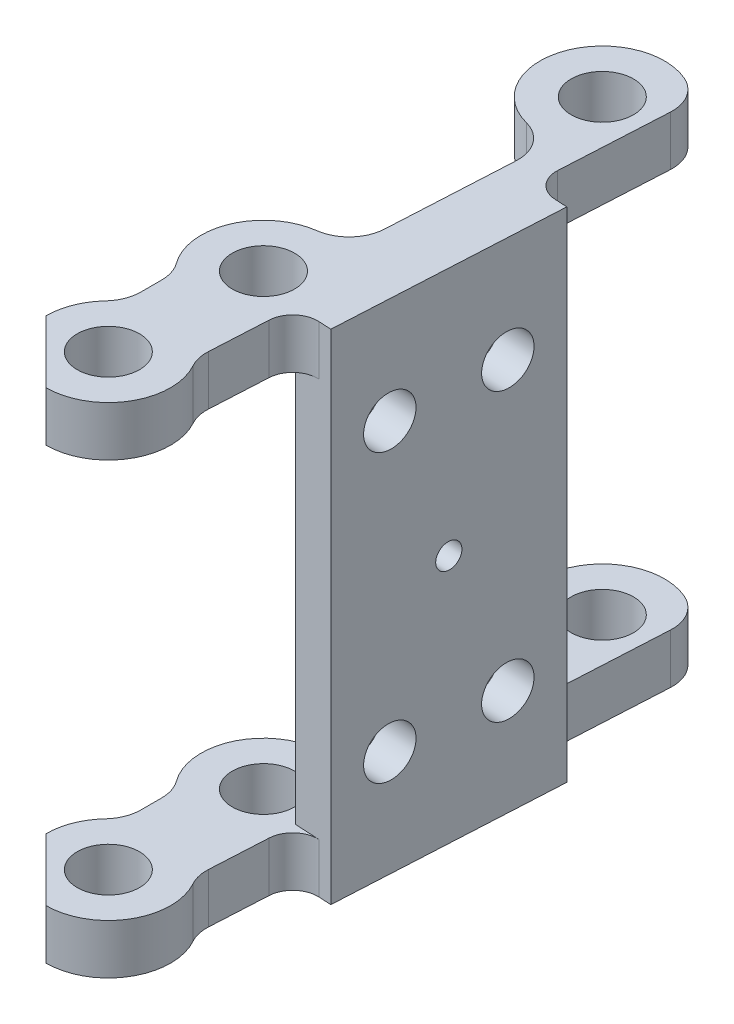
from build123d import *

# Parameters (mm, degrees)
SKETCH2_R           = 2.5
BOSS_EXTRUDE3_DEPTH = 4
BOSS_EXTRUDE4_DEPTH = 40
FILLET1_R           = 2
SKETCH4_R           = 2
SKETCH4_R_2         = 1
CUT_EXTRUDE1_DEPTH  = 10
FILLET3_R           = 3
FILLET4_R           = 3


with BuildPart() as part:
    # Sketch2 → Boss-Extrude3 (new body)
    with BuildSketch(Plane(origin=(0, 0, 0), x_dir=(1, 0, 0), z_dir=(0, 1, 0))):
        with BuildLine():
            ThreePointArc((83.62627208, 73.409646321), (82.043328915, 71.619198109), (81.472187529, 69.298592288))
            Line((81.472187529, 69.298592288), (86.472187529, 64.298592288))
            ThreePointArc((86.472187529, 64.298592288), (90.961711336, 67.097643404), (90.424672494, 72.360921892))
            Line((90.424672494, 72.360921892), (90.926689774, 81.686644374))
            Line((90.926689774, 81.686644374), (92.048119667, 102.518883374))
            Line((92.048119667, 102.518883374), (92.450855554, 110.000305351))
            ThreePointArc((92.450855554, 110.000305351), (83.843337657, 108.444197301), (89.726552777, 101.971283238))
            Line((89.726552777, 101.971283238), (88.863578179, 85.80252536))
            ThreePointArc((88.863578179, 85.80252536), (82.866493913, 83.799788509), (83.62627208, 77.522949199))
            Line((83.62627208, 77.522949199), (83.62627208, 73.409646321))
        make_face()
        with Locations((86.472187529, 69.298592288)):
            Circle(SKETCH2_R, mode=Mode.SUBTRACT)
        with Locations((87.092070964, 81.126869023)):
            Circle(SKETCH2_R, mode=Mode.SUBTRACT)
        with Locations((88.578200606, 106.837625529)):
            Circle(SKETCH2_R, mode=Mode.SUBTRACT)
    boss_extrude3 = extrude(amount=BOSS_EXTRUDE3_DEPTH)

    # Sketch3 → Boss-Extrude4 (add)
    with BuildSketch(Plane(origin=(0, 4, 0), x_dir=(1, 0, 0), z_dir=(0, 1, 0))):
        Polygon((91.800965367, 97.92762227), (90.833399946, 79.953646162), (93.833399946, 79.792151774), (94.800965367, 97.766127883), align=None)
    extrude(amount=-BOSS_EXTRUDE4_DEPTH)

    # Mirror1: Boss-Extrude3 across plane
    add(boss_extrude3.mirror(Plane.ZX.offset(-16)))

    # Fillet1
    fillet1_edges = [part.edges().sort_by_distance(p)[0] for p in [
        (90.833399946, -34, -79.953646162),
        (90.833399946, 2, -79.953646162),
        (91.800965367, -34, -97.92762227),
        (91.800965367, 2, -97.92762227),
    ]]
    fillet(fillet1_edges, radius=FILLET1_R)

    # Sketch4 → Cut-Extrude1 (cut)
    with BuildSketch(Plane(origin=(86.279355648, 0, 4.6445439), x_dir=(-0.05375363451621944, 0, 0.9985542282601866), z_dir=(-0.9985542282601865, 0, -0.05375363451621943))):
        with Locations((-89.220676822, -4.5)):
            Circle(SKETCH4_R)
        with Locations((-98.220676822, -4.5)):
            Circle(SKETCH4_R)
        with Locations((-89.220676822, -27.5)):
            Circle(SKETCH4_R)
        with Locations((-98.220676822, -27.5)):
            Circle(SKETCH4_R)
        with Locations((-93.720676822, -16)):
            Circle(SKETCH4_R_2)
    extrude(amount=-CUT_EXTRUDE1_DEPTH, mode=Mode.SUBTRACT)

    # Fillet3
    fillet3_edges = [part.edges().sort_by_distance(p)[0] for p in [
        (92.450855554, -34, -110.000305351),
        (92.450855554, 2, -110.000305351),
        (90.424672494, -34, -72.360921892),
        (90.424672494, 2, -72.360921892),
        (89.726552777, -34, -101.971283238),
        (89.726552777, 2, -101.971283238),
        (83.62627208, 2, -73.409646321),
        (83.62627208, 2, -77.522949199),
        (83.62627208, -34, -73.409646321),
        (83.62627208, -34, -77.522949199),
    ]]
    fillet(fillet3_edges, radius=FILLET3_R)

    # Fillet4
    fillet4_edges = [part.edges().sort_by_distance(p)[0] for p in [
        (88.863578179, -34, -85.80252536),
        (88.863578179, 2, -85.80252536),
    ]]
    fillet(fillet4_edges, radius=FILLET4_R)


solid = part.part
